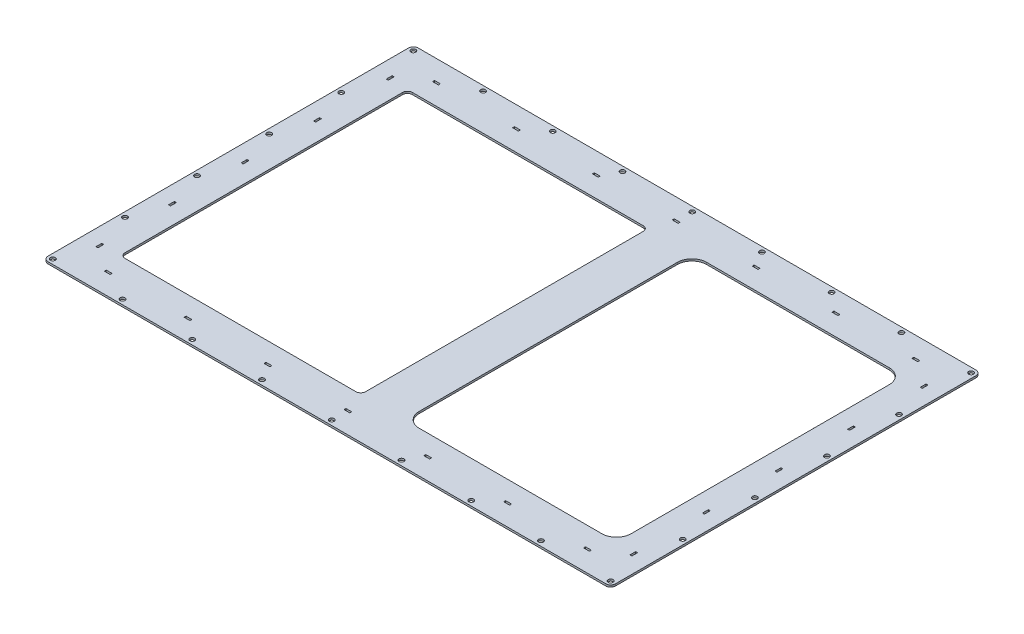
from build123d import *

# Parameters (mm, degrees)
SKETCH_1_W                  = 1165
SKETCH_1_H                  = 760
SKETCH_1_W_2                = 494
SKETCH_1_H_2                = 590
SKETCH_1_W_3                = 435
EXTRUDE_1_DEPTH             = 2
FILLET_1_R                  = 10
FILLET_2_R                  = 30
SKETCH_2_R                  = 5
CUT_EXTRUDE_1_DEPTH         = 696.501437813
PATTERN_LINEAR_1_COUNT      = 6
PATTERN_LINEAR_1_PITCH      = 148
PATTERN_LINEAR_1_COUNT_DIR2 = 9
PATTERN_LINEAR_1_PITCH_DIR2 = 143.125
SKETCH_3_W                  = 12
SKETCH_3_H                  = 4
SKETCH_3_W_2                = 4
SKETCH_3_H_2                = 12
CUT_EXTRUDE_2_DEPTH         = 696.501437813


with BuildPart() as part:
    # Эскиз1 → Бобышка-Вытянуть1 (new, symmetric)
    with BuildSketch(Plane(origin=(0, 0, 0), x_dir=(1, 0, 0), z_dir=(0, 1, 0))):
        Rectangle(SKETCH_1_W, SKETCH_1_H)
        with Locations((-262.5, 0)):
            Rectangle(SKETCH_1_W_2, SKETCH_1_H_2, mode=Mode.SUBTRACT)
        with Locations((292, 0)):
            Rectangle(SKETCH_1_W_3, SKETCH_1_H_2, mode=Mode.SUBTRACT)
    extrude(amount=EXTRUDE_1_DEPTH, both=True)

    # Скругление1
    fillet_1_edges = [part.edges().sort_by_distance(p)[0] for p in [
        (582.5, 0, 380),
        (-582.5, 0, 380),
        (582.5, 0, -380),
        (-582.5, 0, -380),
        (-15.5, 0, 295),
        (-509.5, 0, 295),
        (-15.5, 0, -295),
        (-509.5, 0, -295),
    ]]
    fillet(fillet_1_edges, radius=FILLET_1_R)

    # Скругление2
    fillet_2_edges = [part.edges().sort_by_distance(p)[0] for p in [
        (74.5, 0, 295),
        (509.5, 0, 295),
        (509.5, 0, -295),
        (74.5, 0, -295),
    ]]
    fillet(fillet_2_edges, radius=FILLET_2_R)

    # Эскиз2 → Вырез-Вытянуть1 (cut, through all)
    with BuildSketch(Plane(origin=(0, 2, 0), x_dir=(1, 0, 0), z_dir=(0, 1, 0))):
        with Locations((-572.5, -370)):
            Circle(SKETCH_2_R)
    cut_extrude_1 = extrude(amount=-CUT_EXTRUDE_1_DEPTH, mode=Mode.SUBTRACT)

    # Линейный массив1: Cut-Extrude 1 6 × 9, 25 skipped
    with Locations(*[(j * PATTERN_LINEAR_1_PITCH_DIR2, 0, -i * PATTERN_LINEAR_1_PITCH) for i in range(PATTERN_LINEAR_1_COUNT) for j in range(PATTERN_LINEAR_1_COUNT_DIR2) if (i, j) not in ((0, 0), (1, 1), (1, 2), (1, 3), (1, 4), (1, 5), (1, 6), (1, 7), (2, 1), (2, 2), (2, 3), (2, 4), (2, 5), (2, 6), (2, 7), (3, 1), (3, 2), (3, 3), (3, 4), (3, 5), (3, 6), (3, 7), (4, 1), (4, 2), (4, 3), (4, 4))]):
        add(cut_extrude_1, mode=Mode.SUBTRACT)

    # Эскиз3 → Вырез-Вытянуть2 (cut, through all)
    with BuildSketch(Plane(origin=(0, 2, 0), x_dir=(1, 0, 0), z_dir=(0, 1, 0))):
        with Locations((492, 337)):
            Rectangle(SKETCH_3_W, SKETCH_3_H)
        with Locations((328, 337)):
            Rectangle(SKETCH_3_W, SKETCH_3_H)
        with Locations((0, 337)):
            Rectangle(SKETCH_3_W, SKETCH_3_H)
        with Locations((164, 337)):
            Rectangle(SKETCH_3_W, SKETCH_3_H)
        with Locations((-492, 337)):
            Rectangle(SKETCH_3_W, SKETCH_3_H)
        with Locations((-164, 337)):
            Rectangle(SKETCH_3_W, SKETCH_3_H)
        with Locations((-328, 337)):
            Rectangle(SKETCH_3_W, SKETCH_3_H)
        with Locations((492, -337)):
            Rectangle(SKETCH_3_W, SKETCH_3_H)
        with Locations((328, -337)):
            Rectangle(SKETCH_3_W, SKETCH_3_H)
        with Locations((0, -337)):
            Rectangle(SKETCH_3_W, SKETCH_3_H)
        with Locations((164, -337)):
            Rectangle(SKETCH_3_W, SKETCH_3_H)
        with Locations((-492, -337)):
            Rectangle(SKETCH_3_W, SKETCH_3_H)
        with Locations((-164, -337)):
            Rectangle(SKETCH_3_W, SKETCH_3_H)
        with Locations((-328, -337)):
            Rectangle(SKETCH_3_W, SKETCH_3_H)
        with Locations((-548, 149)):
            Rectangle(SKETCH_3_W_2, SKETCH_3_H_2)
        with Locations((-548, 298)):
            Rectangle(SKETCH_3_W_2, SKETCH_3_H_2)
        with Locations((-548, -149)):
            Rectangle(SKETCH_3_W_2, SKETCH_3_H_2)
        with Locations((-548, 0)):
            Rectangle(SKETCH_3_W_2, SKETCH_3_H_2)
        with Locations((-548, -298)):
            Rectangle(SKETCH_3_W_2, SKETCH_3_H_2)
        with Locations((548, -149)):
            Rectangle(SKETCH_3_W_2, SKETCH_3_H_2)
        with Locations((548, -298)):
            Rectangle(SKETCH_3_W_2, SKETCH_3_H_2)
        with Locations((548, 149)):
            Rectangle(SKETCH_3_W_2, SKETCH_3_H_2)
        with Locations((548, 0)):
            Rectangle(SKETCH_3_W_2, SKETCH_3_H_2)
        with Locations((548, 298)):
            Rectangle(SKETCH_3_W_2, SKETCH_3_H_2)
    extrude(amount=-CUT_EXTRUDE_2_DEPTH, mode=Mode.SUBTRACT)


solid = part.part
